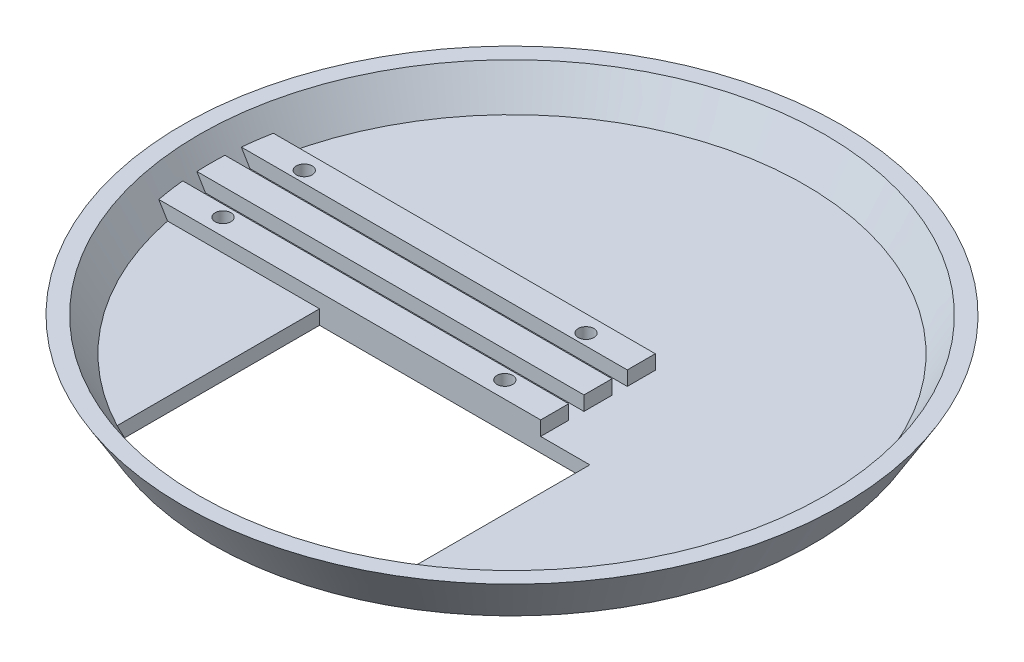
from build123d import *

# Parameters (mm, degrees)
CUT_EXTRUDE1_DEPTH       = 98.831487774
BOSS_EXTRUDE1_DEPTH      = 10
BOSS_EXTRUDE1_DEPTH_BACK = 63.5
SKETCH4_W                = 5.866666667
SKETCH4_H                = 3
SKETCH4_W_2              = 5.866666666
SKETCH5_R                = 1.65
CUT_EXTRUDE2_DEPTH       = 99.091793744
SKETCH8_W                = 5.866666667
SKETCH8_H                = 3
SKETCH8_W_2              = 5.866666666
BOSS_EXTRUDE3_DEPTH      = 8


with BuildPart() as part:
    # Sketch1 → Revolve1 (revolve)
    with BuildSketch(Plane.XY):
        Polygon((0, 0), (63, 0), (69, 10), (65.501428863, 10), (61.301428863, 3), (0, 3), align=None)
    revolve(axis=Axis((0, 0, 0), (0, 1, 0)))

    # Sketch2 → Cut-Extrude1 (cut, through all)
    with BuildSketch(Plane(origin=(0, 3, 0), x_dir=(1, 0, 0), z_dir=(0, 1, 0))):
        with BuildLine():
            Line((-28.3, -12), (-28.3, -54.378076287))
            ThreePointArc((-28.3, -54.378076287), (0, -61.301428863), (28.3, -54.378076287))
            Line((28.3, -54.378076287), (28.3, -12))
            Line((28.3, -12), (-28.3, -12))
        make_face()
    extrude(amount=-CUT_EXTRUDE1_DEPTH, mode=Mode.SUBTRACT)

    # Sketch4 → Boss-Extrude1 (add, two sides: drawn at the far end of the back side and taken through both)
    with BuildSketch(Plane(origin=(0, 0, 0), x_dir=(0, 0, -1), z_dir=(1, 0, 0)).offset(-BOSS_EXTRUDE1_DEPTH_BACK)):
        with Locations((-9.066666666, 4.5)):
            Rectangle(SKETCH4_W, SKETCH4_H)
        with Locations((0, 4.5)):
            Rectangle(SKETCH4_W_2, SKETCH4_H)
        with Locations((9.066666666, 4.5)):
            Rectangle(SKETCH4_W, SKETCH4_H)
    extrude(amount=BOSS_EXTRUDE1_DEPTH + BOSS_EXTRUDE1_DEPTH_BACK)

    # Sketch5 → Cut-Extrude2 (cut, through all)
    with BuildSketch(Plane(origin=(0, 0, 0), x_dir=(1, 0, 0), z_dir=(0, 1, 0))):
        with Locations((7, -8.5)):
            Circle(SKETCH5_R)
        with Locations((7, 8.5)):
            Circle(SKETCH5_R)
        with Locations((-52, 8.5)):
            Circle(SKETCH5_R)
        with Locations((-52, -8.5)):
            Circle(SKETCH5_R)
    extrude(amount=CUT_EXTRUDE2_DEPTH, mode=Mode.SUBTRACT)

    # Sketch8 → Boss-Extrude3 (add)
    with BuildSketch(Plane(origin=(10, 0, 0), x_dir=(0, 0, -1), z_dir=(1, 0, 0))):
        with Locations((-9.066666666, 4.5)):
            Rectangle(SKETCH8_W, SKETCH8_H)
        with Locations((0, 4.5)):
            Rectangle(SKETCH8_W_2, SKETCH8_H)
        with Locations((9.066666666, 4.5)):
            Rectangle(SKETCH8_W, SKETCH8_H)
    extrude(amount=BOSS_EXTRUDE3_DEPTH)


solid = part.part
